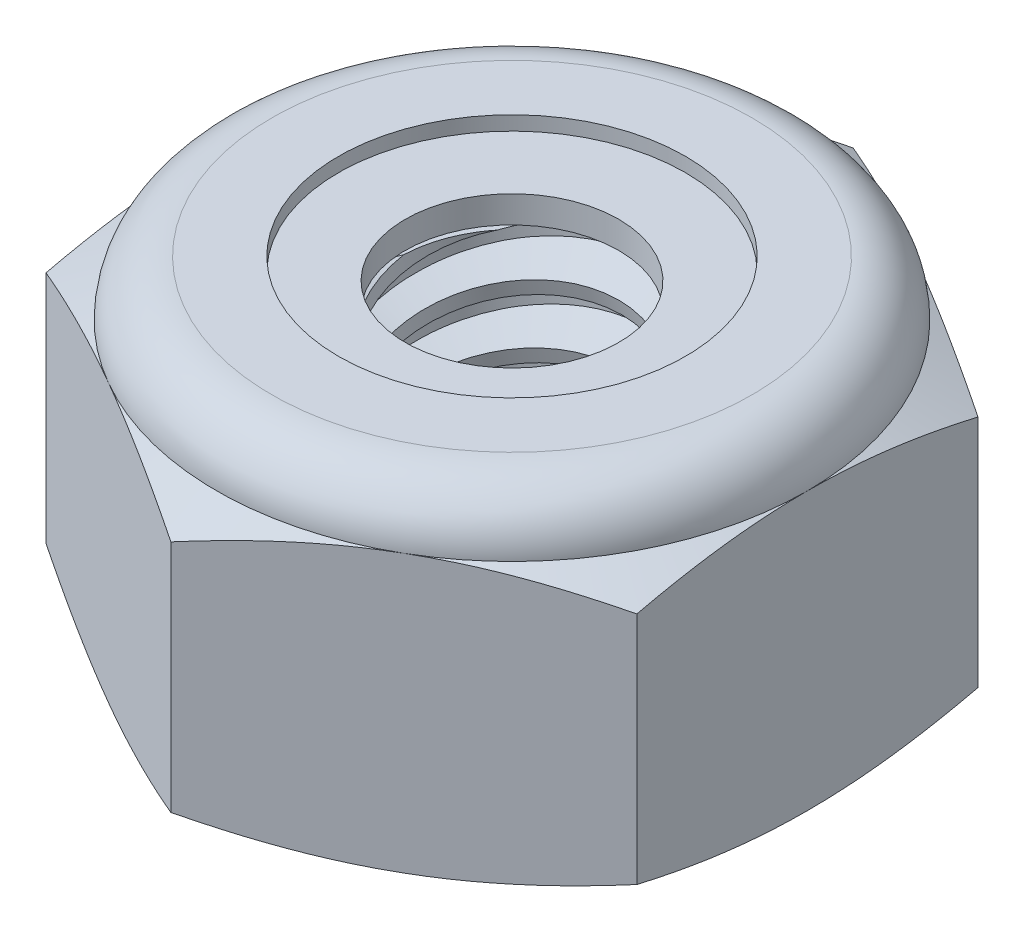
from build123d import *

# Parameters (mm, degrees)
EXTRUDE1_DEPTH       = 3.571875
SKETCH2_W            = 1.4224
SKETCH2_H            = 3.571875
LPATTERN1_COUNT      = 6
LPATTERN1_PITCH      = 0.635
LPATTERN1_COUNT_DIR2 = 2
LPATTERN1_PITCH_DIR2 = 0.635


with BuildPart() as part:
    # Sketch1 → Extrude1 (new body)
    with BuildSketch(Plane(origin=(0, 0, 0), x_dir=(1, 0, 0), z_dir=(0, 1, 0))):
        Polygon((0, 3.666174209), (-3.175, 1.833087105), (-3.175, -1.833087105), (0, -3.666174209), (3.175, -1.833087105), (3.175, 1.833087105), align=None)
    extrude(amount=EXTRUDE1_DEPTH)

    # Sketch4 → Cut-Revolve2 (revolve, cut)
    with BuildSketch(Plane(origin=(0, 0, 0), x_dir=(0, 0, -1), z_dir=(1, 0, 0))):
        Polygon((0, 3.571875), (1.4224, 3.571875), (1.147473684, 3.443674754), (1.147473684, 0.128200246), (1.4224, 0), (0, 0), align=None)
    revolve(axis=Axis((0, 3.571875, 0), (0, 1, 0)), mode=Mode.SUBTRACT)


with BuildPart() as body_2:
    # Sketch2 → Revolve1 (revolve)
    with BuildSketch(Plane(origin=(0, 0, 0), x_dir=(0, 0, -1), z_dir=(1, 0, 0))):
        with Locations((0.7112, 1.7859375)):
            Rectangle(SKETCH2_W, SKETCH2_H)
    revolve(axis=Axis((0, -1.4224, 0), (0, 1, 0)))

    # Sketch3 → Cut-Revolve1 (revolve, cut)
    with BuildSketch(Plane(origin=(0, 0, 0), x_dir=(0, 0, -1), z_dir=(1, 0, 0))):
        Polygon((1.439692084, 3.494406462), (1.560736676, 2.952126693), (1.182057853, 3.070921117), (1.147473684, 3.225858194), align=None)
    cut_revolve1 = revolve(axis=Axis((0, 3.571875, 0.152561988), (0, -0.9759815859905214, -0.21785303258716968)), mode=Mode.SUBTRACT)

    # LPattern1: Cut-Revolve1 6 × 2
    with Locations(*[Vector(0, -1, 0) * (i * LPATTERN1_PITCH) + Vector(0, 1, 0) * (j * LPATTERN1_PITCH_DIR2) for i in range(LPATTERN1_COUNT) for j in range(LPATTERN1_COUNT_DIR2) if (i, j) != (0, 0)]):
        add(cut_revolve1, mode=Mode.SUBTRACT)


with BuildPart() as part_1:
    add(part.part)

    # Combine1: cut body 2
    add(body_2.part, mode=Mode.SUBTRACT)

    # Sketch5 → Cut-Revolve3 (revolve, cut)
    with BuildSketch(Plane(origin=(0, 0, 0), x_dir=(0, 0, -1), z_dir=(1, 0, 0))):
        with BuildLine():
            Line((0, 0), (3.175, 0))
            Line((3.175, 0), (3.666174209, 0.229038295))
            Line((3.666174209, 0.229038295), (3.666174209, 2.747524205))
            Line((3.666174209, 2.747524205), (3.175, 2.9765625))
            ThreePointArc((3.175, 2.9765625), (3.000637006, 3.397512006), (2.5796875, 3.571875))
            Line((2.5796875, 3.571875), (2.5796875, 4.841875))
            Line((2.5796875, 4.841875), (4.936174209, 4.841875))
            Line((4.936174209, 4.841875), (4.936174209, -1.27))
            Line((4.936174209, -1.27), (0, -1.27))
            Line((0, -1.27), (0, 0))
        make_face()
    revolve(axis=Axis((0, 0, 0), (0, 1, 0)), mode=Mode.SUBTRACT)

    # Sketch6 → Cut-Revolve4 (revolve, cut)
    with BuildSketch(Plane(origin=(0, 0, 0), x_dir=(0, 0, -1), z_dir=(1, 0, 0))):
        with BuildLine():
            Line((0, 2.9765625), (3.0226, 2.9765625))
            ThreePointArc((3.0226, 2.9765625), (2.892873932, 3.289748932), (2.5796875, 3.419475))
            Line((2.5796875, 3.419475), (1.863580592, 3.419475))
            Line((1.863580592, 3.419475), (1.863580592, 4.841875))
            Line((1.863580592, 4.841875), (0, 4.841875))
            Line((0, 4.841875), (0, 2.9765625))
        make_face()
    revolve(axis=Axis((0, 4.841875, 0), (0, 1, 0)), mode=Mode.SUBTRACT)


with BuildPart() as body_2_2:
    # Sketch7 → Revolve2 (revolve)
    with BuildSketch(Plane(origin=(0, 0, 0), x_dir=(0, 0, -1), z_dir=(1, 0, 0))):
        with BuildLine():
            Line((1.147473684, 3.0527625), (2.938395763, 3.0527625))
            ThreePointArc((2.938395763, 3.0527625), (2.810484559, 3.261537543), (2.5796875, 3.343275))
            Line((2.5796875, 3.343275), (1.147473684, 3.343275))
            Line((1.147473684, 3.343275), (1.147473684, 3.0527625))
        make_face()
    revolve(axis=Axis((0, 3.0527625, 0), (0, 1, 0)))


solid = Compound([part_1.part, body_2_2.part])
